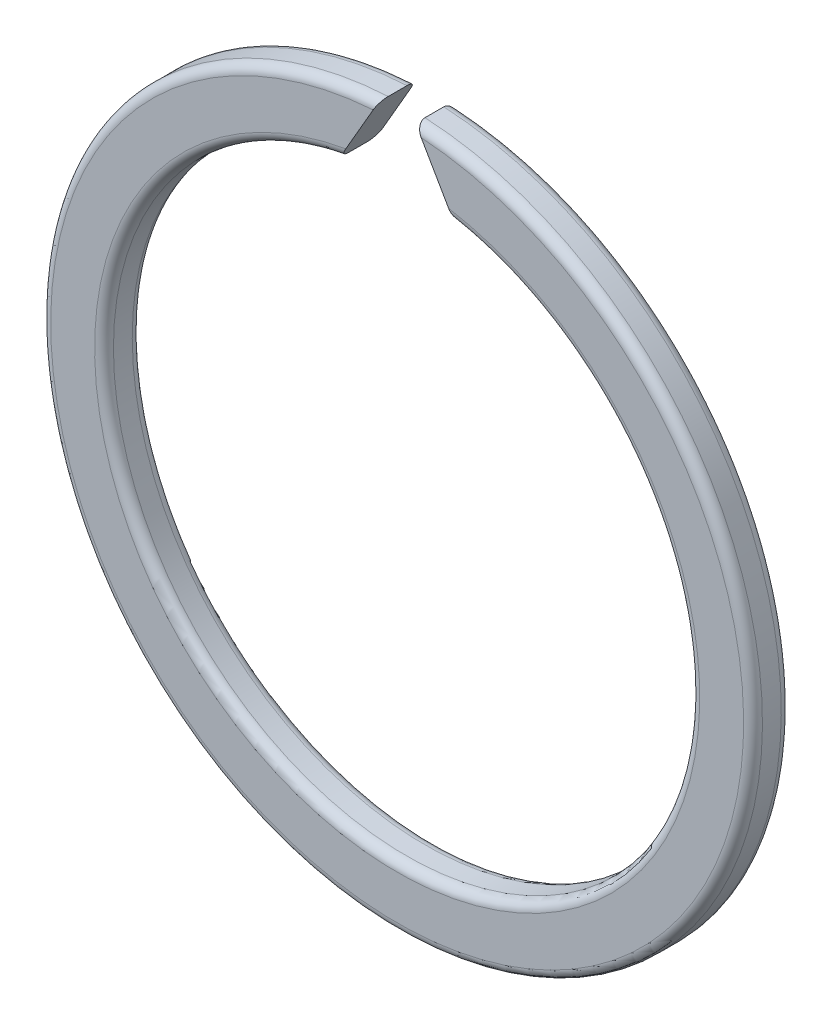
from build123d import *

# Parameters (mm, degrees)
BODYSKE_R      = 11.35
BODYSKE_R_2    = 9.35
BASEBODY_DEPTH = 1.2
SLIT_DEPTH     = 17.096117544
FILLET1_R      = 0.3


with BuildPart() as part:
    # BodySke → BaseBody (new body)
    with BuildSketch(Plane.XY):
        Circle(BODYSKE_R)
        Circle(BODYSKE_R_2, mode=Mode.SUBTRACT)
    extrude(amount=BASEBODY_DEPTH)

    # SlitSke → Slit (cut, through all)
    with BuildSketch(Plane.XY):
        Polygon((0, 12.35), (-1.837298238, 9.167706103), (1.837298238, 9.167706103), align=None)
    extrude(amount=SLIT_DEPTH, mode=Mode.SUBTRACT)

    # Fillet1
    fillet1_edges = [part.edges().sort_by_distance(p)[0] for p in [
        (0, -9.35, 0),
        (-7.815700448, -8.230268921, 0),
        (0, -9.35, 1.2),
        (-7.815700448, -8.230268921, 1.2),
    ]]
    fillet(fillet1_edges, radius=FILLET1_R)


solid = part.part
